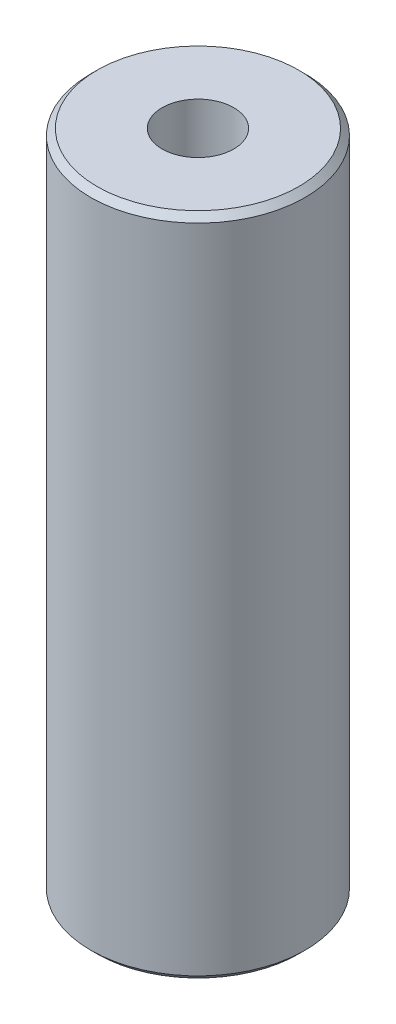
from build123d import *

# Parameters (mm, degrees)
SKETCH1_R           = 52.5
BOSS_EXTRUDE1_DEPTH = 325.546605547
SKETCH2_R           = 17.555506081
CUT_EXTRUDE1_DEPTH  = 334.905813641
CHAMFER1_SIZE       = 3.092613595


with BuildPart() as part:
    # Sketch1 → Boss-Extrude1 (new body)
    with BuildSketch(Plane(origin=(0, 0, 0), x_dir=(1, 0, 0), z_dir=(0, 1, 0))):
        Circle(SKETCH1_R)
    extrude(amount=BOSS_EXTRUDE1_DEPTH)

    # Sketch2 → Cut-Extrude1 (cut, through all)
    with BuildSketch(Plane(origin=(0, 0, 0), x_dir=(1, 0, 0), z_dir=(0, 1, 0))):
        Circle(SKETCH2_R)
    extrude(amount=CUT_EXTRUDE1_DEPTH, mode=Mode.SUBTRACT)

    # Chamfer1
    chamfer1_edges = [part.edges().sort_by_distance(p)[0] for p in [
        (-52.5, 325.546605547, 0),
        (-52.5, 0, 0),
    ]]
    chamfer(chamfer1_edges, length=CHAMFER1_SIZE)


solid = part.part
